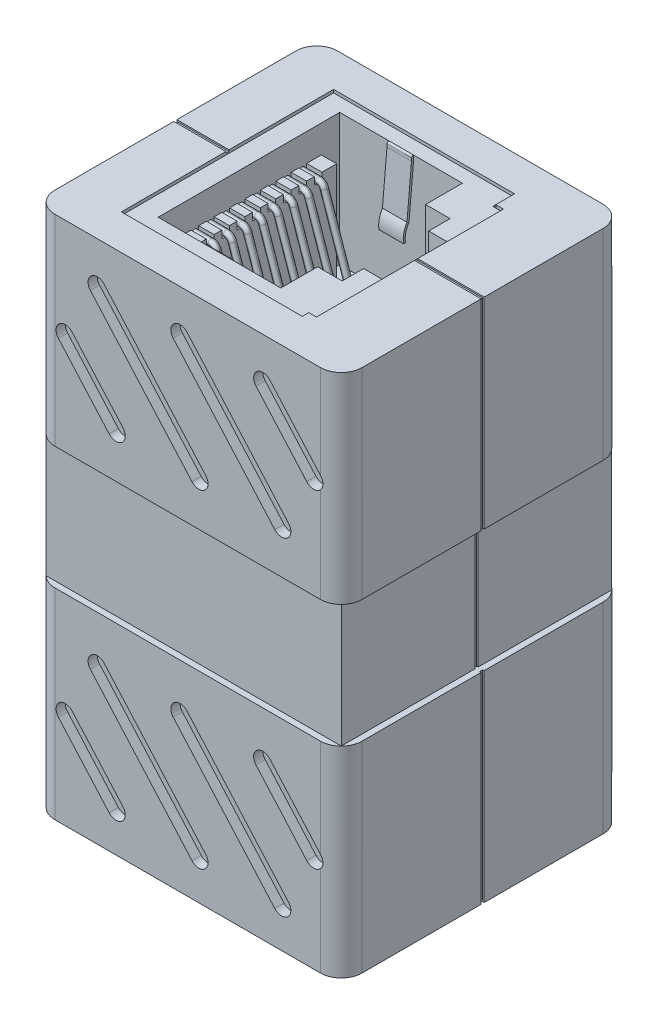
from build123d import *

# Parameters (mm, degrees)
BOSS_EXTRUDE1_DEPTH = 43.434
CUT_EXTRUDE4_DEPTH  = 0.254
CUT_EXTRUDE7_DEPTH  = 0.127
CUT_EXTRUDE8_DEPTH  = 0.127
CUT_EXTRUDE9_DEPTH  = 0.127
CUT_EXTRUDE10_DEPTH = 0.127
SKETCH10_W          = 34.52990355814737
SKETCH10_H          = 10.16
CUT_EXTRUDE11_DEPTH = 0.508
SKETCH11_W          = 26.798954763938067
SKETCH11_H          = 10.16
CUT_EXTRUDE12_DEPTH = 0.508
SKETCH12_W          = 28.975112761690504
SKETCH12_H          = 10.160000000000007
CUT_EXTRUDE13_DEPTH = 0.508
SKETCH13_W          = 35.660667317405796
SKETCH13_H          = 10.16
CUT_EXTRUDE14_DEPTH = 0.508
CUT_EXTRUDE15_DEPTH = 0.127
CUT_EXTRUDE16_DEPTH = 0.127
CUT_EXTRUDE17_DEPTH = 0.762
CUT_EXTRUDE18_DEPTH = 0.127
CUT_EXTRUDE19_DEPTH = 0.762
CUT_EXTRUDE20_DEPTH = 10.16
FILLET1_R           = 1.7272
BOSS_EXTRUDE2_DEPTH = 1.016
BOSS_EXTRUDE3_DEPTH = 1.27
SKETCH23_W          = 0.6350000000000007
SKETCH23_H          = 0.634999999999998
SKETCH23_W_2        = 0.6349999999999993
SKETCH23_W_3        = 0.635
SKETCH23_W_4        = 0.6350000000000002
SKETCH23_W_5        = 0.6350000000000001
SKETCH23_H_2        = 0.6349999999999909
CUT_EXTRUDE24_DEPTH = 1.27
CUT_EXTRUDE25_DEPTH = 1.27
BOSS_EXTRUDE4_DEPTH = 0.508
FILLET2_R           = 0.254
LPATTERN1_COUNT     = 8
LPATTERN1_PITCH     = 1.27
BOSS_EXTRUDE5_DEPTH = 0.508
FILLET3_R           = 0.254
LPATTERN7_COUNT     = 8
LPATTERN7_PITCH     = 1.27


with BuildPart() as part:
    # Sketch1 → Boss-Extrude1 (new body)
    with BuildSketch(Plane(origin=(0, 0, 0), x_dir=(1, 0, 0), z_dir=(0, 1, 0))):
        Polygon((-9.398677205363015, 11.819721269929905), (9.905322794636982, 11.819721269929905), (12.979208144955399, 11.819721269929905), (12.979208144955399, 8.745835919611455), (12.979208144955436, -8.526164080388543), (12.979208144955436, -11.600049430706978), (9.905322794637001, -11.600049430706978), (-9.398677205362997, -11.600049430706978), (-12.472562555681431, -11.600049430706978), (-12.472562555681431, -8.526164080388543), (-12.472562555681433, 8.745835919611455), (-12.472562555681433, 11.819721269929897), align=None)
    extrude(amount=BOSS_EXTRUDE1_DEPTH)

    # Sketch5 → Cut-Extrude4 (cut)
    with BuildSketch(Plane(origin=(0, 43.434, 0), x_dir=(1, 0, 0), z_dir=(0, 1, 0))):
        Polygon((6.831437444318564, 8.898721269929904), (6.831437444318564, 7.348835919611461), (7.466437444318566, 7.348835919611461), (7.466437444318567, -8.145164080388538), (6.831437444318567, -8.145164080388538), (6.831437444318567, -8.67904943070698), (-8.154562555681432, -8.67904943070698), (-8.154562555681434, 8.898721269929903), align=None)
        Polygon((6.704437444318565, 8.771721269929904), (-8.027562555681433, 8.771721269929904), (-8.027562555681431, -8.55204943070698), (6.704437444318567, -8.552049430706978), (6.704437444318567, -8.018164080388537), (7.339437444318566, -8.018164080388537), (7.339437444318566, 7.221835919611461), (6.704437444318565, 7.221835919611461), align=None, mode=Mode.SUBTRACT)
    cut_extrude4 = extrude(amount=-CUT_EXTRUDE4_DEPTH, mode=Mode.SUBTRACT)

    # Sketch6 → Cut-Extrude7 (cut)
    with BuildSketch(Plane(origin=(0, 43.434, 0), x_dir=(1, 0, 0), z_dir=(0, 1, 0))):
        Polygon((12.979208144955418, 0.2368359196114556), (-12.472562555681431, 0.23683591961145245), (-12.472562555681431, -0.01716408038854753), (12.979208144955418, -0.01716408038854441), align=None)
    extrude(amount=-CUT_EXTRUDE7_DEPTH, mode=Mode.SUBTRACT)

    # Sketch7 → Cut-Extrude8 (cut)
    with BuildSketch(Plane(origin=(12.979208144955399, 0, 0), x_dir=(-2.11e-15, 0, -1), z_dir=(1, 0, -2.11e-15))):
        Polygon((-0.01716408038857179, 43.306999999999995), (0.2368359196114282, 43.306999999999995), (0.23683591961142816, 0), (-0.0171640803885722, 0), align=None)
    extrude(amount=-CUT_EXTRUDE8_DEPTH, mode=Mode.SUBTRACT)

    # Sketch8 → Cut-Extrude9 (cut)
    with BuildSketch(Plane.ZY.offset(12.472562555681431)):
        Polygon((-0.2368359196114537, 43.306999999999995), (0.01716408038854628, 43.306999999999995), (0.01716408038854638, 0), (-0.23683591961145395, 0), align=None)
    extrude(amount=-CUT_EXTRUDE9_DEPTH, mode=Mode.SUBTRACT)

    # Sketch9 → Cut-Extrude10 (cut)
    with BuildSketch(Plane.XZ):
        Polygon((-12.34556255568143, 0.01716408038854762), (-12.34556255568143, -0.2368359196114527), (12.852208144955418, -0.23683591961145528), (12.852208144955418, 0.01716408038854509), align=None)
    extrude(amount=-CUT_EXTRUDE10_DEPTH, mode=Mode.SUBTRACT)

    # Sketch10 → Cut-Extrude11 (cut)
    with BuildSketch(Plane.XY.offset(11.600049430706978)):
        with Locations((0.25332279463700935, 21.717000000000006)):
            Rectangle(SKETCH10_W, SKETCH10_H)
    extrude(amount=-CUT_EXTRUDE11_DEPTH, mode=Mode.SUBTRACT)

    # Sketch11 → Cut-Extrude12 (cut)
    with BuildSketch(Plane(origin=(12.979208144955399, 0, 0), x_dir=(0, 0, -1), z_dir=(1, 0, 0))):
        with Locations((-0.01716408038857331, 21.717)):
            Rectangle(SKETCH11_W, SKETCH11_H)
    extrude(amount=-CUT_EXTRUDE12_DEPTH, mode=Mode.SUBTRACT)

    # Sketch12 → Cut-Extrude13 (cut)
    with BuildSketch(Plane(origin=(-3.335e-14, 0, -11.81972126992993), x_dir=(-1, 0, 2.82e-15), z_dir=(-2.82e-15, 0, -1))):
        with Locations((-0.2533227946370138, 21.850074199242897)):
            Rectangle(SKETCH12_W, SKETCH12_H)
    extrude(amount=-CUT_EXTRUDE13_DEPTH, mode=Mode.SUBTRACT)

    # Sketch13 → Cut-Extrude14 (cut)
    with BuildSketch(Plane.ZY.offset(12.472562555681431)):
        with Locations((0.01716408038853601, 21.717)):
            Rectangle(SKETCH13_W, SKETCH13_H)
    extrude(amount=-CUT_EXTRUDE14_DEPTH, mode=Mode.SUBTRACT)

    # Sketch14 → Cut-Extrude15 (cut)
    with BuildSketch(Plane.ZY.offset(11.96456255568143)):
        Polygon((-0.23683591961145395, 26.796999999999997), (0.01716408038854637, 26.796999999999997), (0.01716408038854637, 16.636999999999997), (-0.2368359196114507, 16.636999999999997), align=None)
    extrude(amount=-CUT_EXTRUDE15_DEPTH, mode=Mode.SUBTRACT)

    # Sketch15 → Cut-Extrude16 (cut)
    with BuildSketch(Plane(origin=(12.4712081449554, 0, 0), x_dir=(0, 0, -1), z_dir=(1, 0, 0))):
        Polygon((-0.01716408038854485, 26.797), (0.23683591961142794, 26.797), (0.2368359196114559, 16.637), (-0.01716408038854443, 16.637), align=None)
    extrude(amount=-CUT_EXTRUDE16_DEPTH, mode=Mode.SUBTRACT)

    # Sketch16 → Cut-Extrude17 (cut)
    with BuildSketch(Plane(origin=(-3.335e-14, 0, -11.81972126992993), x_dir=(-1, 0, 2.82e-15), z_dir=(-2.82e-15, 0, -1))):
        with BuildLine():
            Line((7.8007561821445055, 12.25988573137745), (-0.6136743478686973, 2.747401363159995))
            ThreePointArc((-0.6136743478686973, 2.747401363159995), (-1.689289241762547, 2.681518132867737), (-1.7551724720548019, 3.757133026761589))
            Line((-1.7551724720548019, 3.757133026761589), (6.659258057958397, 13.269617394979047))
            ThreePointArc((6.659258057958397, 13.269617394979047), (7.7348729518522585, 13.335500625271312), (7.8007561821445055, 12.25988573137745))
        make_face()
        with BuildLine():
            Line((7.800756182144221, 39.43788573137745), (-0.613674347868982, 29.925401363159995))
            ThreePointArc((-0.613674347868982, 29.925401363159995), (-1.6892892417628325, 29.859518132867738), (-1.7551724720550865, 30.93513302676159))
            Line((-1.7551724720550865, 30.93513302676159), (6.6592580579581115, 40.44761739497905))
            ThreePointArc((6.6592580579581115, 40.44761739497905), (7.734872951851977, 40.51350062527132), (7.800756182144221, 39.43788573137745))
        make_face()
        with BuildLine():
            Line((0.9427561821442129, 39.43788573137746), (-7.471674347868993, 29.925401363159995))
            ThreePointArc((-7.471674347868993, 29.925401363159995), (-8.547289241762831, 29.859518132867752), (-8.61317247205509, 30.935133026761584))
            Line((-8.61317247205509, 30.935133026761584), (-0.19874194204188136, 40.44761739497905))
            ThreePointArc((-0.19874194204188136, 40.44761739497905), (0.8768729518519693, 40.51350062527132), (0.9427561821442129, 39.43788573137746))
        make_face()
        with BuildLine():
            Line((10.451540917137615, 34.68164354726872), (6.244325652131012, 29.925401363159985))
            ThreePointArc((6.244325652131012, 29.925401363159985), (5.168710758237179, 29.859518132867755), (5.102827527944913, 30.935133026761573))
            Line((5.102827527944913, 30.935133026761573), (9.310042792951519, 35.691375210870305))
            ThreePointArc((9.310042792951519, 35.691375210870305), (10.385657686845372, 35.75725844116259), (10.451540917137615, 34.68164354726872))
        make_face()
        with BuildLine():
            Line((-5.915243817855778, 39.437885731377456), (-10.122459082862383, 34.68164354726872))
            ThreePointArc((-10.122459082862383, 34.68164354726872), (-11.198073976756227, 34.61576031697647), (-11.263957207048485, 35.69137521087031))
            Line((-11.263957207048485, 35.69137521087031), (-7.056741942041876, 40.44761739497905))
            ThreePointArc((-7.056741942041876, 40.44761739497905), (-5.981127048148035, 40.5135006252713), (-5.915243817855778, 39.437885731377456))
        make_face()
        with BuildLine():
            Line((0.9427561821444976, 12.259885731377464), (-7.471674347868709, 2.747401363159995))
            ThreePointArc((-7.471674347868709, 2.747401363159995), (-8.547289241762545, 2.681518132867751), (-8.613172472054805, 3.757133026761582))
            Line((-8.613172472054805, 3.757133026761582), (-0.19874194204159668, 13.269617394979047))
            ThreePointArc((-0.19874194204159668, 13.269617394979047), (0.8768729518522512, 13.335500625271312), (0.9427561821444976, 12.259885731377464))
        make_face()
        with BuildLine():
            Line((10.4515409171379, 7.50364354726872), (6.244325652131297, 2.7474013631599847))
            ThreePointArc((6.244325652131297, 2.7474013631599847), (5.168710758237464, 2.6815181328677555), (5.102827527945198, 3.7571330267615712))
            Line((5.102827527945198, 3.7571330267615712), (9.310042792951803, 8.513375210870304))
            ThreePointArc((9.310042792951803, 8.513375210870304), (10.385657686845654, 8.579258441162583), (10.4515409171379, 7.50364354726872))
        make_face()
        with BuildLine():
            Line((-5.915243817855493, 12.259885731377457), (-10.122459082862097, 7.50364354726872))
            ThreePointArc((-10.122459082862097, 7.50364354726872), (-11.198073976755945, 7.437760316976464), (-11.2639572070482, 8.513375210870311))
            Line((-11.2639572070482, 8.513375210870311), (-7.056741942041591, 13.269617394979047))
            ThreePointArc((-7.056741942041591, 13.269617394979047), (-5.981127048147753, 13.335500625271292), (-5.915243817855493, 12.259885731377457))
        make_face()
    cut_extrude17 = extrude(amount=-CUT_EXTRUDE17_DEPTH, mode=Mode.SUBTRACT)

    # Mirror1: Cut-Extrude17 across plane
    add(cut_extrude17.mirror(Plane(origin=(-1.5e-16, 0, -0.10983591961147442), x_dir=(1, 0, -1.41e-15), z_dir=(-1.41e-15, 0, -1))), mode=Mode.SUBTRACT)

    # Sketch17 → Cut-Extrude18 (cut)
    with BuildSketch(Plane(origin=(0, 43.434, 0), x_dir=(1, 0, 0), z_dir=(0, 1, 0))):
        Polygon((6.704437444318567, -8.018164080388537), (6.704437444318567, -8.552049430706978), (-8.027562555681431, -8.552049430706978), (-8.027562555681433, 8.771721269929904), (6.7044374443185655, 8.771721269929904), (6.704437444318565, 7.221835919611461), (7.339437444318565, 7.221835919611461), (7.339437444318566, -8.018164080388537), align=None)
    cut_extrude18 = extrude(amount=-CUT_EXTRUDE18_DEPTH, mode=Mode.SUBTRACT)

    # Sketch18 → Cut-Extrude19 (cut)
    with BuildSketch(Plane(origin=(0, 43.306999999999995, 0), x_dir=(1, 0, 0), z_dir=(0, 1, 0))):
        Polygon((3.783437444318567, -4.3620569099448865), (3.783437444318568, -7.4100569099448865), (-6.376562555681435, -7.410056909944885), (-6.376562555681437, 7.62972874916781), (3.783437444318568, 7.629728749167811), (3.783437444318565, 4.581728749167812), (5.815437444318565, 4.581728749167811), (5.815437444318566, 2.803728749167811), (7.339437444318566, 2.8037287491678105), (7.466437444318566, 2.8037287491678096), (7.466437444318567, -2.5840569099448847), (7.339437444318567, -2.584056909944883), (5.815437444318566, -2.5840569099448865), (5.815437444318566, -4.3620569099448865), align=None)
    cut_extrude19 = extrude(amount=-CUT_EXTRUDE19_DEPTH, mode=Mode.SUBTRACT)

    # Sketch20 → Cut-Extrude20 (cut)
    with BuildSketch(Plane(origin=(0, 42.545, 0), x_dir=(1, 0, 0), z_dir=(0, 1, 0))):
        Polygon((-6.376562555681435, -7.410056909944885), (3.783437444318568, -7.4100569099448865), (3.783437444318567, -4.3620569099448865), (5.815437444318566, -4.3620569099448865), (5.815437444318566, -2.5840569099448865), (6.577437444318567, -2.5840569099448847), (6.577437444318567, 2.8037287491678105), (5.815437444318566, 2.803728749167811), (5.815437444318565, 4.581728749167811), (3.783437444318565, 4.581728749167812), (3.783437444318568, 7.629728749167811), (-6.376562555681437, 7.62972874916781), align=None)
    cut_extrude20 = extrude(amount=-CUT_EXTRUDE20_DEPTH, mode=Mode.SUBTRACT)

    # Fillet1
    # the kernel refuses this fillet: 1.7272 mm, written as the material it takes off along each edge
    with BuildSketch(Plane(origin=(12.979208144955436, -4.318, 11.600049430706978), x_dir=(-1, 0, 0), z_dir=(0, 1, 0))) as fillet1_piece_1:
        with BuildLine():
            CenterArc((FILLET1_R, -FILLET1_R), FILLET1_R, 90, 89.99999999999994)
            Line((0, -FILLET1_R), (0, 0))
            Line((0, 0), (FILLET1_R, 0))
        make_face()
    extrude(amount=25.273000000000003, mode=Mode.SUBTRACT)
    with BuildSketch(Plane(origin=(-12.472562555681431, -4.318, 11.600049430706978), x_dir=(1, 0, 0), z_dir=(0, 1, 0))) as fillet1_piece_2:
        with BuildLine():
            CenterArc((FILLET1_R, FILLET1_R), FILLET1_R, 180, 90)
            Line((0, FILLET1_R), (0, 0))
            Line((0, 0), (FILLET1_R, 0))
        make_face()
    extrude(amount=25.273000000000003, mode=Mode.SUBTRACT)
    with BuildSketch(Plane(origin=(-12.472562555681431, 22.479000000000006, 11.600049430706978), x_dir=(1, 0, 0), z_dir=(0, 1, 0))) as fillet1_piece_3:
        with BuildLine():
            CenterArc((FILLET1_R, FILLET1_R), FILLET1_R, 180, 90)
            Line((0, FILLET1_R), (0, 0))
            Line((0, 0), (FILLET1_R, 0))
        make_face()
    extrude(amount=25.27299999999999, mode=Mode.SUBTRACT)
    with BuildSketch(Plane(origin=(-12.472562555681433, 22.612074199242898, -11.819721269929897), x_dir=(1, 0, -5.14e-15), z_dir=(0, 1, 0))) as fillet1_piece_4:
        with BuildLine():
            CenterArc((FILLET1_R, -FILLET1_R), FILLET1_R, 89.9999999999997, 90.0000000000003)
            Line((-8.88e-15, -FILLET1_R), (0, 0))
            Line((0, 0), (FILLET1_R, 0))
        make_face()
    extrude(amount=25.139925800757098, mode=Mode.SUBTRACT)
    with BuildSketch(Plane(origin=(12.979208144955399, 22.61207419924289, -11.819721269929905), x_dir=(-1, 0, 0), z_dir=(0, 1, 0))) as fillet1_piece_5:
        with BuildLine():
            CenterArc((FILLET1_R, FILLET1_R), FILLET1_R, 180, 90)
            Line((1.78e-15, FILLET1_R), (0, 0))
            Line((0, 0), (FILLET1_R, 0))
        make_face()
    extrude(amount=25.139925800757112, mode=Mode.SUBTRACT)
    with BuildSketch(Plane(origin=(12.979208144955436, 22.479000000000006, 11.600049430706978), x_dir=(-2.16e-14, 0, -1), z_dir=(0, 1, 0))) as fillet1_piece_6:
        with BuildLine():
            CenterArc((FILLET1_R, FILLET1_R), FILLET1_R, 180, 89.99999999999875)
            Line((3.553e-14, FILLET1_R), (0, 0))
            Line((0, 0), (FILLET1_R, 0))
        make_face()
    extrude(amount=25.27299999999999, mode=Mode.SUBTRACT)
    with BuildSketch(Plane(origin=(12.979208144955399, -4.318000000000005, -11.819721269929905), x_dir=(-1, 0, 0), z_dir=(0, 1, 0))) as fillet1_piece_7:
        with BuildLine():
            CenterArc((FILLET1_R, FILLET1_R), FILLET1_R, 180, 90)
            Line((1.78e-15, FILLET1_R), (0, 0))
            Line((0, 0), (FILLET1_R, 0))
        make_face()
    extrude(amount=25.27300000000001, mode=Mode.SUBTRACT)
    with BuildSketch(Plane(origin=(-12.472562555681433, -4.318, -11.819721269929897), x_dir=(1, 0, -5.14e-15), z_dir=(0, 1, 0))) as fillet1_piece_8:
        with BuildLine():
            CenterArc((FILLET1_R, -FILLET1_R), FILLET1_R, 89.9999999999997, 90.0000000000003)
            Line((-8.88e-15, -FILLET1_R), (0, 0))
            Line((0, 0), (FILLET1_R, 0))
        make_face()
    extrude(amount=25.272999999999993, mode=Mode.SUBTRACT)

    # Sketch21 → Boss-Extrude2 (add, symmetric)
    with BuildSketch(Plane.ZY.offset(1.296562555681437)):
        with BuildLine():
            Line((-7.478534301795838, 42.930431540551254), (-7.102540316587996, 38.73752150515167))
            add(Edge.make_bspline(
                [(-7.102540316587996, 38.73752150515167), (-6.7035830881416585, 38.08309925043688), (-6.8186600030281825, 37.3348187793267)],
                knots=[0, 0, 0, 1, 1, 1], degree=2))
            Line((-6.8186600030281825, 37.3348187793267), (-6.98564842276925, 37.3348187793267))
            add(Edge.make_bspline(
                [(-6.98564842276925, 37.3348187793267), (-6.858751654396808, 38.05379980688193), (-7.272163287161582, 38.66316910596031)],
                knots=[0, 0, 0, 1, 1, 1], degree=2))
            Line((-7.272163287161582, 38.66316910596031), (-7.629728749167807, 42.650572822350725))
            Line((-7.629728749167807, 42.650572822350725), (-7.629728749167807, 43.18))
            Line((-7.629728749167807, 43.18), (-7.629728749167807, 43.306999999999995))
            add(Edge.make_bspline(
                [(-7.629728749167807, 43.306999999999995), (-7.5124826407877485, 43.28272495945866), (-7.493108786646204, 43.16206622217283)],
                knots=[0, 0, 0, 1, 1, 1], degree=2))
            Line((-7.493108786646204, 43.16206622217283), (-7.478534301795838, 42.930431540551254))
        make_face()
        with BuildLine():
            Line((7.410056909944887, 43.306999999999995), (7.410056909944887, 43.18))
            Line((7.410056909944887, 43.18), (7.410056909944887, 42.650572822350725))
            Line((7.410056909944887, 42.650572822350725), (7.052491447938662, 38.66316910596031))
            add(Edge.make_bspline(
                [(6.76597658354633, 37.3348187793267), (6.639079815173887, 38.05379980688193), (7.052491447938662, 38.66316910596031)],
                knots=[0, 0, 0, 1, 1, 1], degree=2))
            Line((6.76597658354633, 37.3348187793267), (6.598988163805263, 37.3348187793267))
            add(Edge.make_bspline(
                [(6.882868477365077, 38.73752150515167), (6.483911248918738, 38.08309925043688), (6.598988163805263, 37.3348187793267)],
                knots=[0, 0, 0, 1, 1, 1], degree=2))
            Line((6.882868477365077, 38.73752150515167), (7.258862462572918, 42.930431540551254))
            Line((7.258862462572918, 42.930431540551254), (7.273436947423284, 43.16206622217283))
            add(Edge.make_bspline(
                [(7.410056909944887, 43.306999999999995), (7.292810801564829, 43.282724959458655), (7.273436947423284, 43.16206622217283)],
                knots=[0, 0, 0, 1, 1, 1], degree=2))
        make_face()
    boss_extrude2 = extrude(amount=BOSS_EXTRUDE2_DEPTH, both=True)

    # Sketch22 → Boss-Extrude3 (add)
    with BuildSketch(Plane(origin=(-6.376562555681436, 0, 7.4e-16), x_dir=(-1.2e-16, 0, -1), z_dir=(1, 0, -1.2e-16))):
        Polygon((6.105728749167811, 32.385), (-5.886056909944885, 32.385), (-5.886056909944884, 41.021), (6.10572874916781, 41.021), align=None)
    boss_extrude3 = extrude(amount=BOSS_EXTRUDE3_DEPTH)

    # Sketch23 → Cut-Extrude24 (cut)
    with BuildSketch(Plane(origin=(-5.106562555681435, 0, 7.4e-16), x_dir=(-1.4e-16, 0, -1), z_dir=(1, 0, -1.4e-16))):
        with Locations((4.569028749167812, 40.703500000000005)):
            Rectangle(SKETCH23_W, SKETCH23_H)
        with Locations((3.291771606310668, 40.70349999999999)):
            Rectangle(SKETCH23_W_2, SKETCH23_H)
        with Locations((2.014514463453525, 40.70349999999998)):
            Rectangle(SKETCH23_W_3, SKETCH23_H)
        with Locations((0.7372573205963817, 40.70349999999998)):
            Rectangle(SKETCH23_W_4, SKETCH23_H)
        with Locations((-0.5399998222607614, 40.70349999999996)):
            Rectangle(SKETCH23_W_5, SKETCH23_H)
        with Locations((-1.8172569651179045, 40.70349999999996)):
            Rectangle(SKETCH23_W_4, SKETCH23_H)
        with Locations((-3.094514107975048, 40.70349999999995)):
            Rectangle(SKETCH23_W_4, SKETCH23_H_2)
        with Locations((-4.3717712508321895, 40.70349999999994)):
            Rectangle(SKETCH23_W, SKETCH23_H_2)
    cut_extrude24 = extrude(amount=-CUT_EXTRUDE24_DEPTH, mode=Mode.SUBTRACT)

    # Sketch25 → Cut-Extrude25 (cut)
    with BuildSketch(Plane(origin=(0, 32.385, 0), x_dir=(1, 0, 0), z_dir=(0, 1, 0))):
        Polygon((-2.3162637207621475, 3.616528749167811), (-2.3162637207621475, 2.98152874916781), (-1.6812637207621475, 2.98152874916781), (-1.6812637207621473, 3.61652874916781), align=None)
        Polygon((-1.6812637207621606, 4.886528749167811), (-2.316263720762161, 4.8865287491678115), (-2.316263720762161, 4.25152874916781), (-1.6812637207621608, 4.25152874916781), align=None)
        Polygon((-2.316263720762134, 2.346528749167811), (-2.316263720762134, 1.7115287491678102), (-1.6812637207621342, 1.7115287491678102), (-1.681263720762134, 2.34652874916781), align=None)
        Polygon((-2.316263720762121, 1.0765287491678113), (-2.316263720762121, 0.4415287491678103), (-1.6812637207621208, 0.4415287491678103), (-1.6812637207621206, 1.0765287491678104), align=None)
        Polygon((-2.3162637207621075, -0.19347125083218897), (-2.3162637207621075, -0.82847125083219), (-1.6812637207621077, -0.82847125083219), (-1.6812637207621075, -0.19347125083218983), align=None)
        Polygon((-2.316263720762094, -1.4634712508321892), (-2.316263720762094, -2.09847125083219), (-1.6812637207620942, -2.09847125083219), (-1.681263720762094, -1.46347125083219), align=None)
        Polygon((-2.316263720762081, -2.7334712508321886), (-2.316263720762081, -3.3684712508321897), (-1.681263720762081, -3.3684712508321897), (-1.6812637207620809, -2.7334712508321894), align=None)
        Polygon((-2.3162637207620675, -4.003471250832189), (-2.3162637207620675, -4.63847125083219), (-1.6812637207620678, -4.63847125083219), (-1.6812637207620675, -4.00347125083219), align=None)
    cut_extrude25 = extrude(amount=-CUT_EXTRUDE25_DEPTH, mode=Mode.SUBTRACT)

    # Mirror11: Cut-Extrude4 across plane
    add(cut_extrude4.mirror(Plane.ZX.offset(21.717)), mode=Mode.SUBTRACT)

    # Mirror12: Cut-Extrude18 across plane
    add(cut_extrude18.mirror(Plane.ZX.offset(21.717)), mode=Mode.SUBTRACT)

    # Mirror14: Cut-Extrude19 across plane
    add(cut_extrude19.mirror(Plane.ZX.offset(21.717)), mode=Mode.SUBTRACT)

    # Mirror16: Cut-Extrude20 across plane
    add(cut_extrude20.mirror(Plane.ZX.offset(21.717)), mode=Mode.SUBTRACT)

    # Mirror17: Boss-Extrude2 across plane
    add(boss_extrude2.mirror(Plane.ZX.offset(21.717)))

    # Mirror18: Boss-Extrude3 across plane
    add(boss_extrude3.mirror(Plane.ZX.offset(21.717)))

    # Mirror19: Cut-Extrude24 across plane
    add(cut_extrude24.mirror(Plane.ZX.offset(21.717)), mode=Mode.SUBTRACT)

    # Mirror20: Cut-Extrude25 across plane
    add(cut_extrude25.mirror(Plane.ZX.offset(21.717)), mode=Mode.SUBTRACT)


with BuildPart() as body_2:
    # Sketch26 → Boss-Extrude4 (new body)
    with BuildSketch(Plane(origin=(-6.2e-16, 0, -4.251528749167811), x_dir=(-1, 0, 1.4e-16), z_dir=(-1.4e-16, 0, -1))):
        with BuildLine():
            Line((4.294838982621036, 40.443071380180896), (1.9514582531555884, 33.621671758790356))
            ThreePointArc((1.9514582531555884, 33.621671758790356), (1.7967926038174014, 33.01131233533853), (1.7447637207620683, 32.383814857885696))
            Line((1.7447637207620683, 32.383814857885696), (1.7447637207620683, 31.115))
            Line((1.7447637207620683, 31.115), (2.252763720762068, 31.115))
            Line((2.252763720762068, 31.115), (2.2527637207620685, 32.08787657192374))
            Line((2.2527637207620685, 32.08787657192374), (2.2527637207620685, 32.298990172270436))
            ThreePointArc((2.2527637207620685, 32.298990172270436), (2.3047926038174, 32.92648764972327), (2.459458253155588, 33.536847073175096))
            Line((2.459458253155588, 33.536847073175096), (4.775279711635239, 40.27802379339362))
            ThreePointArc((4.775279711635239, 40.27802379339362), (4.867928133554976, 40.40223297211858), (5.015500076142336, 40.44949999999998))
            Line((5.015500076142336, 40.44949999999998), (6.376562555681436, 40.44949999999998))
            Line((6.376562555681436, 40.44949999999998), (6.376562555681436, 40.957499999999975))
            Line((6.376562555681436, 40.957499999999975), (5.015500076142276, 40.957499999999975))
            ThreePointArc((5.015500076142276, 40.957499999999975), (4.572784248380225, 40.81569891635578), (4.294838982621036, 40.443071380180896))
        make_face()
    extrude(amount=BOSS_EXTRUDE4_DEPTH)

    # Fillet2
    # the kernel refuses this fillet: 0.254 mm, written as the material it takes off along each edge
    with BuildSketch(Plane(origin=(-2.2527637207620694, 32.298990172270436, -4.759528749167811), x_dir=(1, 3.8e-16, 3.5e-15), z_dir=(3.8e-16, -1, 0))) as fillet2_piece_1:
        with BuildLine():
            CenterArc((FILLET2_R, FILLET2_R), FILLET2_R, 180, 89.99999999999977)
            Line((8.9e-16, FILLET2_R), (0, 0))
            Line((0, 0), (FILLET2_R, 0))
        make_face()
    extrude(amount=1.8189901722704356, mode=Mode.SUBTRACT)
    with BuildSketch(Plane(origin=(-6.062763720762018, 32.298990172270464, -4.75952874916781), x_dir=(1, -7.46e-15, -2.3e-16), z_dir=(-7.46e-15, -1, 0))) as fillet2_piece_2:
        with BuildLine():
            CenterArc((3.8099999999999494 + FILLET2_R, FILLET2_R), FILLET2_R, 180.0000000000002, 89.99999999999977)
            Line((3.80999999999995, FILLET2_R), (3.8099999999999494, 0))
            Line((3.8099999999999494, 0), (3.8099999999999494 + FILLET2_R, 9.5e-16))
        make_face()
    revolve(axis=Axis((-6.062763720762018, 32.298990172270464, -4.75952874916781), (1.4e-16, 0, 1)), revolution_arc=18.95932424452324, mode=Mode.SUBTRACT)
    with BuildSketch(Plane(origin=(-5.015500076142337, 40.44949999999998, -4.75952874916781), x_dir=(0, 1, 0), z_dir=(-1, 0, 1.4e-16))) as fillet2_piece_3:
        with BuildLine():
            CenterArc((FILLET2_R, -FILLET2_R), FILLET2_R, 90, 90)
            Line((0, -FILLET2_R), (0, 0))
            Line((0, 0), (FILLET2_R, 0))
        make_face()
    extrude(amount=1.9960624795390984, mode=Mode.SUBTRACT)
    with BuildSketch(Plane(origin=(-5.0155000761423425, 40.195499999999974, -4.75952874916781), x_dir=(0.9457494665633758, 0.32489682438443435, 0), z_dir=(0.32489682438443435, -0.9457494665633758, 0))) as fillet2_piece_4:
        with BuildLine():
            CenterArc((0.2540000000000045 + FILLET2_R, FILLET2_R), FILLET2_R, 180, 90)
            Line((0.2540000000000045, FILLET2_R), (0.2540000000000045, 0))
            Line((0.2540000000000045, 0), (0.2540000000000045 + FILLET2_R, 0))
        make_face()
    revolve(axis=Axis((-5.0155000761423425, 40.195499999999974, -4.75952874916781), (1.4e-16, 0, 1)), revolution_arc=71.04067575547532, mode=Mode.SUBTRACT)
    with BuildSketch(Plane(origin=(-7.011562555681436, 40.957499999999975, -4.75952874916781), x_dir=(0, -1, 0), z_dir=(1, 0, -1.4e-16))) as fillet2_piece_5:
        with BuildLine():
            CenterArc((FILLET2_R, -FILLET2_R), FILLET2_R, 90, 90)
            Line((0, -FILLET2_R), (0, 0))
            Line((0, 0), (FILLET2_R, 0))
        make_face()
    extrude(amount=1.9960624795391588, mode=Mode.SUBTRACT)
    with BuildSketch(Plane(origin=(-5.01550007614233, 40.19549999999998, -4.75952874916781), x_dir=(6.994e-14, 1, 0), z_dir=(-1, 6.994e-14, 1.4e-16))) as fillet2_piece_6:
        with BuildLine():
            CenterArc((0.7619999999999933 - FILLET2_R, -FILLET2_R), FILLET2_R, 0, 90)
            Line((0.7619999999999933, -FILLET2_R), (0.7619999999999933, 0))
            Line((0.7619999999999933, 0), (0.7619999999999933 - FILLET2_R, 0))
        make_face()
    revolve(axis=Axis((-5.01550007614233, 40.19549999999998, -4.75952874916781), (-1.4e-16, 0, -1)), revolution_arc=71.04067575547418, mode=Mode.SUBTRACT)
    with BuildSketch(Plane(origin=(-1.744763720762069, 32.383814857885696, -4.759528749167811), x_dir=(0, 0, 1), z_dir=(0, -1, 0))) as fillet2_piece_7:
        with BuildLine():
            CenterArc((FILLET2_R, FILLET2_R), FILLET2_R, 179.99999999999994, 90.00000000000006)
            Line((-8.9e-16, FILLET2_R), (0, 0))
            Line((0, 0), (FILLET2_R, 0))
        make_face()
    extrude(amount=1.903814857885699, mode=Mode.SUBTRACT)
    with BuildSketch(Plane(origin=(-5.554763720762112, 32.38381485788571, -4.75952874916781), x_dir=(0.9457494665633815, 0.3248968243844179, 0), z_dir=(-0.3248968243844179, 0.9457494665633815, 0))) as fillet2_piece_8:
        with BuildLine():
            CenterArc((3.8100000000000405 - FILLET2_R, -FILLET2_R), FILLET2_R, 1.8783e-13, 89.99999999999983)
            Line((3.8100000000000405, -FILLET2_R), (3.8100000000000405, 0))
            Line((3.8100000000000405, 0), (3.8100000000000405 - FILLET2_R, -8.3e-16))
        make_face()
    revolve(axis=Axis((-5.554763720762112, 32.38381485788571, -4.75952874916781), (-1.4e-16, 0, -1)), revolution_arc=18.959324244522783, mode=Mode.SUBTRACT)
    with BuildSketch(Plane(origin=(-2.252763720762068, 30.479999999999997, -4.251528749167811), x_dir=(-1.75e-15, 0, -1), z_dir=(-3.8e-16, 1, 0))) as fillet2_piece_9:
        with BuildLine():
            CenterArc((FILLET2_R, -FILLET2_R), FILLET2_R, 89.9999999999999, 90.00000000000017)
            Line((-4.4e-16, -FILLET2_R), (0, 0))
            Line((0, 0), (FILLET2_R, 0))
        make_face()
    extrude(amount=1.8189901722704391, mode=Mode.SUBTRACT)
    with BuildSketch(Plane(origin=(-6.062763720762018, 32.298990172270464, -4.25152874916781), x_dir=(1, -7.46e-15, -2.3e-16), z_dir=(-7.46e-15, -1, 0))) as fillet2_piece_10:
        with BuildLine():
            CenterArc((3.80999999999995 + FILLET2_R, -FILLET2_R), FILLET2_R, 89.9999999999996, 90.0000000000004)
            Line((3.80999999999995 + FILLET2_R, 6e-17), (3.80999999999995, 0))
            Line((3.80999999999995, 0), (3.8099999999999494, -FILLET2_R))
        make_face()
    revolve(axis=Axis((-6.062763720762018, 32.298990172270464, -4.25152874916781), (1.4e-16, 0, 1)), revolution_arc=18.95932424452324, mode=Mode.SUBTRACT)
    with BuildSketch(Plane(origin=(-5.015500076142337, 40.44949999999998, -4.25152874916781), x_dir=(-1.4e-16, 0, -1), z_dir=(-1, 0, 1.4e-16))) as fillet2_piece_11:
        with BuildLine():
            CenterArc((FILLET2_R, -FILLET2_R), FILLET2_R, 90, 90)
            Line((-8.9e-16, -FILLET2_R), (0, 0))
            Line((0, 0), (FILLET2_R, 0))
        make_face()
    extrude(amount=1.9960624795390984, mode=Mode.SUBTRACT)
    with BuildSketch(Plane(origin=(-5.0155000761423425, 40.195499999999974, -4.25152874916781), x_dir=(0.9457494665633758, 0.32489682438443435, 0), z_dir=(0.32489682438443435, -0.9457494665633758, 0))) as fillet2_piece_12:
        with BuildLine():
            CenterArc((0.2540000000000045 + FILLET2_R, -FILLET2_R), FILLET2_R, 89.99999999999984, 90.00000000000017)
            Line((0.2540000000000045 + FILLET2_R, 8.9e-16), (0.2540000000000045, 0))
            Line((0.2540000000000045, 0), (0.25400000000000533, -FILLET2_R))
        make_face()
    revolve(axis=Axis((-5.0155000761423425, 40.195499999999974, -4.25152874916781), (1.4e-16, 0, 1)), revolution_arc=71.04067575547532, mode=Mode.SUBTRACT)
    with BuildSketch(Plane(origin=(-7.011562555681436, 40.957499999999975, -4.25152874916781), x_dir=(-1.4e-16, 0, -1), z_dir=(1, 0, -1.4e-16))) as fillet2_piece_13:
        with BuildLine():
            CenterArc((FILLET2_R, -FILLET2_R), FILLET2_R, 90, 90)
            Line((-8.9e-16, -FILLET2_R), (0, 0))
            Line((0, 0), (FILLET2_R, 0))
        make_face()
    extrude(amount=1.9960624795391588, mode=Mode.SUBTRACT)
    with BuildSketch(Plane(origin=(-5.01550007614233, 40.19549999999998, -4.25152874916781), x_dir=(6.994e-14, 1, 0), z_dir=(-1, 6.994e-14, 1.4e-16))) as fillet2_piece_14:
        with BuildLine():
            CenterArc((0.7619999999999933 - FILLET2_R, FILLET2_R), FILLET2_R, 270, 90)
            Line((0.7619999999999933 - FILLET2_R, -8.9e-16), (0.7619999999999933, 0))
            Line((0.7619999999999933, 0), (0.7619999999999933, FILLET2_R))
        make_face()
    revolve(axis=Axis((-5.01550007614233, 40.19549999999998, -4.25152874916781), (-1.4e-16, 0, -1)), revolution_arc=71.04067575547418, mode=Mode.SUBTRACT)
    with BuildSketch(Plane(origin=(-1.744763720762069, 32.383814857885696, -4.251528749167811), x_dir=(0, 0, -1), z_dir=(0, -1, 0))) as fillet2_piece_15:
        with BuildLine():
            CenterArc((FILLET2_R, -FILLET2_R), FILLET2_R, 90, 89.99999999999994)
            Line((0, -FILLET2_R), (0, 0))
            Line((0, 0), (FILLET2_R, 0))
        make_face()
    extrude(amount=1.9038148578856955, mode=Mode.SUBTRACT)
    with BuildSketch(Plane(origin=(-5.554763720762112, 32.38381485788571, -4.25152874916781), x_dir=(0.9457494665633815, 0.3248968243844179, 0), z_dir=(-0.3248968243844179, 0.9457494665633815, 0))) as fillet2_piece_16:
        with BuildLine():
            CenterArc((3.8100000000000405 - FILLET2_R, FILLET2_R), FILLET2_R, 270, 89.99999999999999)
            Line((3.8100000000000405, FILLET2_R), (3.8100000000000405, 0))
            Line((3.8100000000000405, 0), (3.8100000000000405 - FILLET2_R, 6e-17))
        make_face()
    revolve(axis=Axis((-5.554763720762112, 32.38381485788571, -4.25152874916781), (-1.4e-16, 0, -1)), revolution_arc=18.959324244522783, mode=Mode.SUBTRACT)
    with BuildSketch(Plane(origin=(-2.459458253155589, 33.536847073175096, -4.759528749167811), x_dir=(0.9457494665633815, 0.3248968243844175, 0), z_dir=(-0.3248968243844176, 0.9457494665633817, 0))) as fillet2_piece_17:
        with BuildLine():
            CenterArc((FILLET2_R, -FILLET2_R), FILLET2_R, 90, 89.9999999999998)
            Line((-2.1e-16, -FILLET2_R), (0, 0))
            Line((0, 0), (FILLET2_R, 0))
        make_face()
    extrude(amount=7.127867324857487, mode=Mode.SUBTRACT)
    with BuildSketch(Plane(origin=(-4.2948389826210365, 40.443071380180896, -4.75952874916781), x_dir=(-0.9457494665633817, -0.32489682438441747, 0), z_dir=(0.3248968243844175, -0.9457494665633817, 0))) as fillet2_piece_18:
        with BuildLine():
            CenterArc((FILLET2_R, -FILLET2_R), FILLET2_R, 90, 90)
            Line((-8.4e-16, -FILLET2_R), (0, 0))
            Line((0, 0), (FILLET2_R, 0))
        make_face()
    extrude(amount=7.212692010472721, mode=Mode.SUBTRACT)
    with BuildSketch(Plane(origin=(-2.4594582531555886, 33.536847073175096, -4.251528749167811), x_dir=(-3.93e-15, -1.3e-15, -1), z_dir=(-0.3248968243844176, 0.9457494665633817, 0))) as fillet2_piece_19:
        with BuildLine():
            CenterArc((FILLET2_R, -FILLET2_R), FILLET2_R, 89.99999999999977, 90.00000000000011)
            Line((-1.6e-16, -FILLET2_R), (0, 0))
            Line((0, 0), (FILLET2_R, 0))
        make_face()
    extrude(amount=7.127867324857487, mode=Mode.SUBTRACT)
    with BuildSketch(Plane(origin=(-4.2948389826210365, 40.443071380180896, -4.25152874916781), x_dir=(3.11e-15, 1.12e-15, -1), z_dir=(0.3248968243844175, -0.9457494665633817, 0))) as fillet2_piece_20:
        with BuildLine():
            CenterArc((FILLET2_R, -FILLET2_R), FILLET2_R, 89.99999999999982, 90.00000000000001)
            Line((-1.73e-15, -FILLET2_R), (0, 0))
            Line((0, 0), (FILLET2_R, 0))
        make_face()
    extrude(amount=7.212692010472721, mode=Mode.SUBTRACT)


with BuildPart() as lpattern1_1:
    # LPattern1: pattern copy
    add(body_2.part.moved(Location(Vector(0, 0, 1) * (1 * LPATTERN1_PITCH))))


with BuildPart() as lpattern1_2:
    # LPattern1: pattern copy
    add(body_2.part.moved(Location(Vector(0, 0, 1) * (2 * LPATTERN1_PITCH))))


with BuildPart() as lpattern1_3:
    # LPattern1: pattern copy
    add(body_2.part.moved(Location(Vector(0, 0, 1) * (3 * LPATTERN1_PITCH))))


with BuildPart() as lpattern1_4:
    # LPattern1: pattern copy
    add(body_2.part.moved(Location(Vector(0, 0, 1) * (4 * LPATTERN1_PITCH))))


with BuildPart() as lpattern1_5:
    # LPattern1: pattern copy
    add(body_2.part.moved(Location(Vector(0, 0, 1) * (5 * LPATTERN1_PITCH))))


with BuildPart() as lpattern1_6:
    # LPattern1: pattern copy
    add(body_2.part.moved(Location(Vector(0, 0, 1) * (6 * LPATTERN1_PITCH))))


with BuildPart() as lpattern1_7:
    # LPattern1: pattern copy
    add(body_2.part.moved(Location(Vector(0, 0, 1) * (7 * LPATTERN1_PITCH))))


with BuildPart() as body_10:
    # Sketch30 → Boss-Extrude5 (new body)
    with BuildSketch(Plane.XY.offset(4.054271250832189)):
        with BuildLine():
            Line((-4.294838982621037, 2.9909286198190843), (-1.9514582531556355, 9.812328241209654))
            ThreePointArc((-1.9514582531556355, 9.812328241209654), (-1.7967926038174582, 10.422687664661456), (-1.7447637207621278, 11.050185142114259))
            Line((-1.7447637207621278, 11.050185142114259), (-1.744763720762128, 12.319000000000004))
            Line((-1.744763720762128, 12.319000000000004), (-2.252763720762128, 12.319000000000004))
            Line((-2.252763720762128, 12.319000000000004), (-2.2527637207621245, 11.346123428076258))
            Line((-2.2527637207621245, 11.346123428076258), (-2.252763720762125, 11.135009827729531))
            ThreePointArc((-2.252763720762125, 11.135009827729531), (-2.304792603817454, 10.507512350276729), (-2.4594582531556313, 9.897152926824926))
            Line((-2.4594582531556313, 9.897152926824926), (-4.775279711635243, 3.1559762066063652))
            ThreePointArc((-4.775279711635243, 3.1559762066063652), (-4.8679281335549796, 3.0317670278813997), (-5.015500076142342, 2.9845000000000055))
            Line((-5.015500076142342, 2.9845000000000055), (-6.376562555681436, 2.9845000000000055))
            Line((-6.376562555681436, 2.9845000000000055), (-6.376562555681435, 2.4765000000000055))
            Line((-6.376562555681435, 2.4765000000000055), (-5.015500076142335, 2.4765000000000055))
            ThreePointArc((-5.015500076142335, 2.4765000000000055), (-4.57278424838025, 2.618301083644188), (-4.294838982621037, 2.9909286198190843))
        make_face()
    extrude(amount=BOSS_EXTRUDE5_DEPTH)

    # Fillet3
    # the kernel refuses this fillet: 0.254 mm, written as the material it takes off along each edge
    with BuildSketch(Plane(origin=(-2.2527637207621245, 11.135009827729531, 4.562271250832189), x_dir=(1, 2.63e-15, -3.5e-15), z_dir=(-2.63e-15, 1, 0))) as fillet3_piece_1:
        with BuildLine():
            CenterArc((FILLET3_R, FILLET3_R), FILLET3_R, 180, 89.99999999999977)
            Line((8.9e-16, FILLET3_R), (0, 0))
            Line((0, 0), (FILLET3_R, 0))
        make_face()
    extrude(amount=1.8189901722704729, mode=Mode.SUBTRACT)
    with BuildSketch(Plane(origin=(-6.062763720762072, 11.135009827729522, 4.562271250832189), x_dir=(1, 2.33e-15, 0), z_dir=(-2.33e-15, 1, 0))) as fillet3_piece_2:
        with BuildLine():
            CenterArc((3.8099999999999468 + FILLET3_R, FILLET3_R), FILLET3_R, 180.0000000000002, 89.99999999999977)
            Line((3.8099999999999468, FILLET3_R), (3.8099999999999468, 0))
            Line((3.8099999999999468, 0), (3.8099999999999468 + FILLET3_R, 8.9e-16))
        make_face()
    revolve(axis=Axis((-6.062763720762072, 11.135009827729522, 4.562271250832189), (0, 0, -1)), revolution_arc=18.95932424452239, mode=Mode.SUBTRACT)
    with BuildSketch(Plane(origin=(-5.015500076142341, 2.9845000000000055, 4.562271250832189), x_dir=(0, -1, -3.5e-15), z_dir=(-1, 0, 0))) as fillet3_piece_3:
        with BuildLine():
            CenterArc((FILLET3_R, -FILLET3_R), FILLET3_R, 90.0000000000002, 89.9999999999998)
            Line((8.9e-16, -FILLET3_R), (0, 0))
            Line((0, 0), (FILLET3_R, 0))
        make_face()
    extrude(amount=1.996062479539094, mode=Mode.SUBTRACT)
    with BuildSketch(Plane(origin=(-5.015500076142341, 3.2385000000000055, 4.562271250832189), x_dir=(0.9457494665633839, -0.32489682438441103, 0), z_dir=(0.32489682438441103, 0.9457494665633839, 0))) as fillet3_piece_4:
        with BuildLine():
            CenterArc((0.2539999999999995 + FILLET3_R, FILLET3_R), FILLET3_R, 180.0000000000002, 89.99999999999977)
            Line((0.2540000000000005, FILLET3_R), (0.2539999999999995, 0))
            Line((0.2539999999999995, 0), (0.2539999999999995 + FILLET3_R, 8.9e-16))
        make_face()
    revolve(axis=Axis((-5.015500076142341, 3.2385000000000055, 4.562271250832189), (0, 0, -1)), revolution_arc=71.04067575547786, mode=Mode.SUBTRACT)
    with BuildSketch(Plane(origin=(-2.2527637207621294, 12.954000000000004, 4.054271250832189), x_dir=(1.75e-15, 0, 1), z_dir=(2.63e-15, -1, 0))) as fillet3_piece_5:
        with BuildLine():
            CenterArc((FILLET3_R, -FILLET3_R), FILLET3_R, 90.0000000000001, 89.9999999999999)
            Line((4.4e-16, -FILLET3_R), (0, 0))
            Line((0, 0), (FILLET3_R, 0))
        make_face()
    extrude(amount=1.8189901722704729, mode=Mode.SUBTRACT)
    with BuildSketch(Plane(origin=(-6.062763720762072, 11.135009827729522, 4.054271250832189), x_dir=(1, 2.33e-15, 0), z_dir=(-2.33e-15, 1, 0))) as fillet3_piece_6:
        with BuildLine():
            CenterArc((3.8099999999999468 + FILLET3_R, -FILLET3_R), FILLET3_R, 90, 90)
            Line((3.8099999999999468, -FILLET3_R), (3.8099999999999468, 0))
            Line((3.8099999999999468, 0), (3.8099999999999468 + FILLET3_R, 0))
        make_face()
    revolve(axis=Axis((-6.062763720762072, 11.135009827729522, 4.054271250832189), (0, 0, -1)), revolution_arc=18.95932424452239, mode=Mode.SUBTRACT)
    with BuildSketch(Plane(origin=(-5.015500076142341, 2.9845000000000055, 4.054271250832189), x_dir=(0, 0, 1), z_dir=(-1, 0, 0))) as fillet3_piece_7:
        with BuildLine():
            CenterArc((FILLET3_R, -FILLET3_R), FILLET3_R, 90, 90)
            Line((0, -FILLET3_R), (0, 0))
            Line((0, 0), (FILLET3_R, 0))
        make_face()
    extrude(amount=1.996062479539094, mode=Mode.SUBTRACT)
    with BuildSketch(Plane(origin=(-5.015500076142341, 3.2385000000000055, 4.054271250832189), x_dir=(0.9457494665633839, -0.32489682438441103, 0), z_dir=(0.32489682438441103, 0.9457494665633839, 0))) as fillet3_piece_8:
        with BuildLine():
            CenterArc((0.2539999999999995 + FILLET3_R, -FILLET3_R), FILLET3_R, 90, 90)
            Line((0.2540000000000005, -FILLET3_R), (0.2539999999999995, 0))
            Line((0.2539999999999995, 0), (0.2539999999999995 + FILLET3_R, 0))
        make_face()
    revolve(axis=Axis((-5.015500076142341, 3.2385000000000055, 4.054271250832189), (0, 0, -1)), revolution_arc=71.04067575547786, mode=Mode.SUBTRACT)
    with BuildSketch(Plane(origin=(-7.011562555681434, 2.4765000000000055, 4.054271250832189), x_dir=(0, 0, 1), z_dir=(1, 0, 0))) as fillet3_piece_9:
        with BuildLine():
            CenterArc((FILLET3_R, -FILLET3_R), FILLET3_R, 90, 90)
            Line((0, -FILLET3_R), (0, 0))
            Line((0, 0), (FILLET3_R, 0))
        make_face()
    extrude(amount=1.9960624795390993, mode=Mode.SUBTRACT)
    with BuildSketch(Plane(origin=(-5.015500076142337, 3.238500000000008, 4.054271250832189), x_dir=(3.5e-15, -1, 0), z_dir=(-1, -3.5e-15, 0))) as fillet3_piece_10:
        with BuildLine():
            CenterArc((0.7620000000000027 - FILLET3_R, FILLET3_R), FILLET3_R, 270, 90)
            Line((0.7620000000000027 - FILLET3_R, 0), (0.7620000000000027, 0))
            Line((0.7620000000000027, 0), (0.7620000000000027, FILLET3_R))
        make_face()
    revolve(axis=Axis((-5.015500076142337, 3.238500000000008, 4.054271250832189), (0, 0, 1)), revolution_arc=71.04067575547752, mode=Mode.SUBTRACT)
    with BuildSketch(Plane(origin=(-1.7447637207621272, 11.050185142114259, 4.054271250832189), x_dir=(0, 0, 1), z_dir=(-1.8e-16, 1, 0))) as fillet3_piece_11:
        with BuildLine():
            CenterArc((FILLET3_R, -FILLET3_R), FILLET3_R, 90, 90)
            Line((0, -FILLET3_R), (0, 0))
            Line((0, 0), (FILLET3_R, 0))
        make_face()
    extrude(amount=1.9038148578857452, mode=Mode.SUBTRACT)
    with BuildSketch(Plane(origin=(-5.554763720762146, 11.050185142114264, 4.054271250832189), x_dir=(0.945749466563384, -0.3248968243844106, 0), z_dir=(-0.3248968243844106, -0.945749466563384, 0))) as fillet3_piece_12:
        with BuildLine():
            CenterArc((3.8100000000000187 - FILLET3_R, FILLET3_R), FILLET3_R, 270, 90)
            Line((3.8100000000000187 - FILLET3_R, 0), (3.8100000000000187, 0))
            Line((3.8100000000000187, 0), (3.8100000000000187, FILLET3_R))
        make_face()
    revolve(axis=Axis((-5.554763720762146, 11.050185142114264, 4.054271250832189), (0, 0, 1)), revolution_arc=18.959324244522033, mode=Mode.SUBTRACT)
    with BuildSketch(Plane(origin=(-7.011562555681434, 2.4765000000000055, 4.562271250832189), x_dir=(0, 1, -3.5e-15), z_dir=(1, 0, 0))) as fillet3_piece_13:
        with BuildLine():
            CenterArc((FILLET3_R, -FILLET3_R), FILLET3_R, 90.0000000000002, 89.9999999999998)
            Line((8.9e-16, -FILLET3_R), (0, 0))
            Line((0, 0), (FILLET3_R, 0))
        make_face()
    extrude(amount=1.9960624795390993, mode=Mode.SUBTRACT)
    with BuildSketch(Plane(origin=(-5.015500076142337, 3.238500000000008, 4.562271250832189), x_dir=(3.5e-15, -1, 0), z_dir=(-1, -3.5e-15, 0))) as fillet3_piece_14:
        with BuildLine():
            CenterArc((0.7620000000000027 - FILLET3_R, -FILLET3_R), FILLET3_R, 2.0035e-13, 89.99999999999977)
            Line((0.7620000000000027, -FILLET3_R), (0.7620000000000027, 0))
            Line((0.7620000000000027, 0), (0.7620000000000027 - FILLET3_R, -8.9e-16))
        make_face()
    revolve(axis=Axis((-5.015500076142337, 3.238500000000008, 4.562271250832189), (0, 0, 1)), revolution_arc=71.04067575547752, mode=Mode.SUBTRACT)
    with BuildSketch(Plane(origin=(-1.7447637207621272, 11.050185142114259, 4.562271250832189), x_dir=(-1, -1.8e-16, -3.5e-15), z_dir=(-1.8e-16, 1, 0))) as fillet3_piece_15:
        with BuildLine():
            CenterArc((FILLET3_R, -FILLET3_R), FILLET3_R, 90.0000000000002, 89.9999999999998)
            Line((8.9e-16, -FILLET3_R), (0, 0))
            Line((0, 0), (FILLET3_R, 0))
        make_face()
    extrude(amount=1.9038148578857452, mode=Mode.SUBTRACT)
    with BuildSketch(Plane(origin=(-5.554763720762146, 11.050185142114264, 4.562271250832189), x_dir=(0.945749466563384, -0.3248968243844106, 0), z_dir=(-0.3248968243844106, -0.945749466563384, 0))) as fillet3_piece_16:
        with BuildLine():
            CenterArc((3.8100000000000187 - FILLET3_R, -FILLET3_R), FILLET3_R, 2.0035e-13, 89.99999999999977)
            Line((3.8100000000000187, -FILLET3_R), (3.8100000000000187, 0))
            Line((3.8100000000000187, 0), (3.8100000000000187 - FILLET3_R, -8.9e-16))
        make_face()
    revolve(axis=Axis((-5.554763720762146, 11.050185142114264, 4.562271250832189), (0, 0, 1)), revolution_arc=18.959324244522033, mode=Mode.SUBTRACT)
    with BuildSketch(Plane(origin=(-2.459458253155631, 9.897152926824926, 4.562271250832189), x_dir=(1.56e-15, -5.4e-16, -1), z_dir=(-0.32489682438441103, -0.9457494665633839, 0))) as fillet3_piece_17:
        with BuildLine():
            CenterArc((FILLET3_R, FILLET3_R), FILLET3_R, 180, 89.99999999999989)
            Line((-4.7e-16, FILLET3_R), (0, 0))
            Line((0, 0), (FILLET3_R, 0))
        make_face()
    extrude(amount=7.127867324857507, mode=Mode.SUBTRACT)
    with BuildSketch(Plane(origin=(-2.459458253155631, 9.897152926824926, 4.054271250832189), x_dir=(1.56e-15, -5.4e-16, 1), z_dir=(-0.32489682438441103, -0.9457494665633839, 0))) as fillet3_piece_18:
        with BuildLine():
            CenterArc((FILLET3_R, -FILLET3_R), FILLET3_R, 90.0000000000001, 89.9999999999999)
            Line((4.2e-16, -FILLET3_R), (0, 0))
            Line((0, 0), (FILLET3_R, 0))
        make_face()
    extrude(amount=7.127867324857507, mode=Mode.SUBTRACT)
    with BuildSketch(Plane(origin=(-4.2948389826210365, 2.9909286198190843, 4.054271250832189), x_dir=(3.13e-15, -1.07e-15, 1), z_dir=(0.3248968243844107, 0.945749466563384, 0))) as fillet3_piece_19:
        with BuildLine():
            CenterArc((FILLET3_R, -FILLET3_R), FILLET3_R, 89.99999999999982, 90.00000000000018)
            Line((-8.4e-16, -FILLET3_R), (0, 0))
            Line((0, 0), (FILLET3_R, 0))
        make_face()
    extrude(amount=7.2126920104727335, mode=Mode.SUBTRACT)
    with BuildSketch(Plane(origin=(-4.2948389826210365, 2.9909286198190843, 4.562271250832189), x_dir=(-0.945749466563384, 0.3248968243844107, -3.49676543189025e-15), z_dir=(0.3248968243844107, 0.945749466563384, 0))) as fillet3_piece_20:
        with BuildLine():
            CenterArc((FILLET3_R, -FILLET3_R), FILLET3_R, 90.0000000000002, 89.9999999999998)
            Line((8.9e-16, -FILLET3_R), (0, 0))
            Line((0, 0), (FILLET3_R, 0))
        make_face()
    extrude(amount=7.2126920104727335, mode=Mode.SUBTRACT)


with BuildPart() as lpattern7_1:
    # LPattern7: pattern copy
    add(body_10.part.moved(Location(Vector(0, 0, -1) * (1 * LPATTERN7_PITCH))))


with BuildPart() as lpattern7_2:
    # LPattern7: pattern copy
    add(body_10.part.moved(Location(Vector(0, 0, -1) * (2 * LPATTERN7_PITCH))))


with BuildPart() as lpattern7_3:
    # LPattern7: pattern copy
    add(body_10.part.moved(Location(Vector(0, 0, -1) * (3 * LPATTERN7_PITCH))))


with BuildPart() as lpattern7_4:
    # LPattern7: pattern copy
    add(body_10.part.moved(Location(Vector(0, 0, -1) * (4 * LPATTERN7_PITCH))))


with BuildPart() as lpattern7_5:
    # LPattern7: pattern copy
    add(body_10.part.moved(Location(Vector(0, 0, -1) * (5 * LPATTERN7_PITCH))))


with BuildPart() as lpattern7_6:
    # LPattern7: pattern copy
    add(body_10.part.moved(Location(Vector(0, 0, -1) * (6 * LPATTERN7_PITCH))))


with BuildPart() as lpattern7_7:
    # LPattern7: pattern copy
    add(body_10.part.moved(Location(Vector(0, 0, -1) * (7 * LPATTERN7_PITCH))))


solid = Compound([part.part, body_2.part, lpattern1_1.part, lpattern1_2.part, lpattern1_3.part, lpattern1_4.part, lpattern1_5.part, lpattern1_6.part, lpattern1_7.part, body_10.part, lpattern7_1.part, lpattern7_2.part, lpattern7_3.part, lpattern7_4.part, lpattern7_5.part, lpattern7_6.part, lpattern7_7.part])
